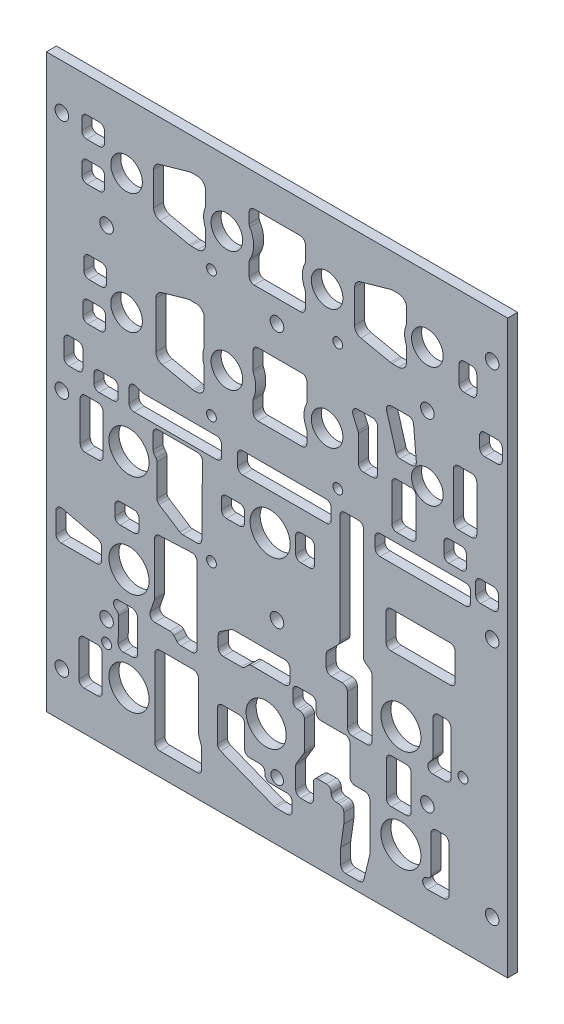
from build123d import *

# Parameters (mm, degrees)
SKETCH1_W                       = 146.05
SKETCH1_H                       = 180.975
BOSS_EXTRUDE1_DEPTH             = 3.175
F_6_CLEARANCE_HOLE1_D           = 4.3053
F_10_0MM_DOWEL_HOLE1_D          = 10
F_1_2_0_5_DIAMETER_HOLE1_D      = 12.7
F_5_32_0_15625_DIAMETER_HOLE1_D = 3.96875
SKETCH14_R                      = 1.5875
SKETCH14_R_2                    = 1.5499969
SKETCH14_R_3                    = 1.55
CUT_EXTRUDE1_DEPTH              = 233.578231462


with BuildPart() as part:
    # Sketch1 → Boss-Extrude1 (new body)
    with BuildSketch(Plane.XY):
        with Locations((-73.025, 90.4875)):
            Rectangle(SKETCH1_W, SKETCH1_H)
    extrude(amount=-BOSS_EXTRUDE1_DEPTH)

    # #6 Clearance Hole1 (through all)
    with Locations(Plane(origin=(0, 0, -3.175), x_dir=(-1, 0, 0), z_dir=(0, 0, -1))):
        with Locations((25.4, 142.875), (73.025, 142.875), (127, 142.875), (25.4, 34.925), (73.025, 61.647038728), (127, 34.925), (4.8895, 14.2875), (141.1605, 14.2875), (4.8895, 90.4875), (141.1605, 90.4875), (141.1605, 166.6875), (4.8895, 166.6875)):
            Hole(F_6_CLEARANCE_HOLE1_D / 2)

    # Ø10.0mm Dowel Hole1 (through all)
    with Locations(Plane(origin=(0, 0, -3.175), x_dir=(-1, 0, 0), z_dir=(0, 0, -1))):
        with Locations((25.4, 160.3248), (57.15, 160.3248), (88.9, 160.3248), (120.65, 160.3248), (25.4, 122.2248), (57.15, 122.2248), (88.9, 122.2248), (120.65, 122.2248)):
            Hole(F_10_0MM_DOWEL_HOLE1_D / 2)

    # 1/2 (0.5) Diameter Hole1 (through all)
    with Locations(Plane(origin=(0, 0, -3.175), x_dir=(-1, 0, 0), z_dir=(0, 0, -1))):
        with Locations((75.184, 84.455), (119.888, 84.455), (119.888, 52.07), (33.782, 52.07), (33.782, 19.685), (119.888, 19.685), (76.454, 31.496)):
            Hole(F_1_2_0_5_DIAMETER_HOLE1_D / 2)

    # 5/32 (0.15625) Diameter Hole1 (through all)
    with Locations(Plane(origin=(0, 0, -3.175), x_dir=(-1, 0, 0), z_dir=(0, 0, -1))):
        with Locations((72.963204011, 18.468172011)):
            Hole(F_5_32_0_15625_DIAMETER_HOLE1_D / 2)

    # Sketch14 → Cut-Extrude1 (cut, through all)
    with BuildSketch(Plane(origin=(0, 0, -3.175), x_dir=(-1, 0, 0), z_dir=(0, 0, -1))):
        with Locations((14.132946824, 47.879219258)):
            Circle(SKETCH14_R)
        with Locations((126.963022534, 28.317577565)):
            Circle(SKETCH14_R)
        with Locations((53.772115863, 147.294739596)):
            Circle(SKETCH14_R_2)
        with Locations((93.772115863, 147.294739596)):
            Circle(SKETCH14_R_3)
        with Locations((53.772115863, 107.294739596)):
            Circle(SKETCH14_R_3)
        with Locations((93.772115863, 107.294739596)):
            Circle(SKETCH14_R_3)
        with Locations((93.772115863, 67.294739596)):
            Circle(SKETCH14_R_3)
        with BuildLine():
            Line((9.767217663, 160.63285084), (9.767217663, 155.327245177))
            ThreePointArc((9.767217663, 155.327245177), (10.232185648, 154.204713162), (11.354717663, 153.739745177))
            Line((11.354717663, 153.739745177), (13.801478439, 153.739745177))
            ThreePointArc((13.801478439, 153.739745177), (14.924010454, 154.204713162), (15.388978439, 155.327245177))
            Line((15.388978439, 155.327245177), (15.388978439, 160.63285084))
            ThreePointArc((15.388978439, 160.63285084), (14.924010454, 161.755382855), (13.801478439, 162.22035084))
            Line((13.801478439, 162.22035084), (11.354717663, 162.22035084))
            ThreePointArc((11.354717663, 162.22035084), (10.232185648, 161.755382855), (9.767217663, 160.63285084))
        make_face()
        with BuildLine():
            Line((34.558637989, 170.414185492), (36.400339795, 170.414185492))
            ThreePointArc((36.400339795, 170.414185492), (36.751612031, 170.389778427), (37.09613346, 170.317026292))
            Line((37.09613346, 170.317026292), (46.619141898, 167.604590452))
            ThreePointArc((46.619141898, 167.604590452), (47.950528037, 166.692155495), (48.463348234, 165.161749652))
            Line((48.463348234, 165.161749652), (48.463348234, 154.740614372))
            ThreePointArc((48.463348234, 154.740614372), (47.896464908, 153.14111114), (46.448851707, 152.255569886))
            Line((46.448851707, 152.255569886), (37.123509045, 150.283573011))
            ThreePointArc((37.123509045, 150.283573011), (36.862190171, 150.242393735), (36.598005572, 150.228617497))
            Line((36.598005572, 150.228617497), (34.558637989, 150.228617497))
            ThreePointArc((34.558637989, 150.228617497), (32.762586765, 150.972566273), (32.018637989, 152.768617497))
            Line((32.018637989, 152.768617497), (32.018637989, 156.939609479))
            ThreePointArc((32.018637989, 156.939609479), (32.057812591, 157.383988064), (32.17412801, 157.814659282))
            ThreePointArc((32.17412801, 157.814659282), (32.61698961, 160.306947565), (32.17412801, 162.799235847))
            ThreePointArc((32.17412801, 162.799235847), (32.057812591, 163.229907066), (32.018637989, 163.67428565))
            Line((32.018637989, 163.67428565), (32.018637989, 167.874185492))
            ThreePointArc((32.018637989, 167.874185492), (32.762586765, 169.670236716), (34.558637989, 170.414185492))
        make_face()
        with BuildLine():
            Line((98.211458819, 170.8080376), (100.053160625, 170.8080376))
            ThreePointArc((100.053160625, 170.8080376), (100.40443286, 170.783630536), (100.748954289, 170.710878401))
            Line((100.748954289, 170.710878401), (110.271962728, 167.998442561))
            ThreePointArc((110.271962728, 167.998442561), (111.603348866, 167.086007604), (112.116169063, 165.55560176))
            Line((112.116169063, 165.55560176), (112.116169063, 155.13446648))
            ThreePointArc((112.116169063, 155.13446648), (111.549285738, 153.534963248), (110.101672537, 152.649421994))
            Line((110.101672537, 152.649421994), (100.776329875, 150.677425119))
            ThreePointArc((100.776329875, 150.677425119), (100.515011, 150.636245843), (100.250826401, 150.622469606))
            Line((100.250826401, 150.622469606), (98.211458819, 150.622469606))
            ThreePointArc((98.211458819, 150.622469606), (96.415407595, 151.366418381), (95.671458819, 153.162469606))
            Line((95.671458819, 153.162469606), (95.671458819, 157.333461588))
            ThreePointArc((95.671458819, 157.333461588), (95.71063342, 157.777840172), (95.82694884, 158.208511391))
            ThreePointArc((95.82694884, 158.208511391), (96.26981044, 160.700799673), (95.82694884, 163.193087955))
            ThreePointArc((95.82694884, 163.193087955), (95.71063342, 163.623759174), (95.671458819, 164.068137758))
            Line((95.671458819, 164.068137758), (95.671458819, 168.2680376))
            ThreePointArc((95.671458819, 168.2680376), (96.415407595, 170.064088824), (98.211458819, 170.8080376))
        make_face()
        with BuildLine():
            Line((81.82809692, 169.167810595), (81.82809692, 165.880408811))
            ThreePointArc((81.82809692, 165.880408811), (81.772213791, 165.462909096), (81.608498795, 165.074803008))
            ThreePointArc((81.608498795, 165.074803008), (80.416199874, 160.700799673), (81.608498795, 156.326796338))
            ThreePointArc((81.608498795, 156.326796338), (81.772213791, 155.938690249), (81.82809692, 155.521190535))
            Line((81.82809692, 155.521190535), (81.82809692, 151.496551485))
            ThreePointArc((81.82809692, 151.496551485), (81.363128935, 150.37401947), (80.24059692, 149.909051485))
            Line((80.24059692, 149.909051485), (65.652230002, 149.909051485))
            ThreePointArc((65.652230002, 149.909051485), (64.529697987, 150.37401947), (64.064730002, 151.496551485))
            Line((64.064730002, 151.496551485), (64.064730002, 156.208791944))
            ThreePointArc((64.064730002, 156.208791944), (64.104453531, 156.561700215), (64.221636141, 156.896947054))
            ThreePointArc((64.221636141, 156.896947054), (64.999149824, 160.306947565), (64.221636141, 163.716948075))
            ThreePointArc((64.221636141, 163.716948075), (64.104453531, 164.052194914), (64.064730002, 164.405103185))
            Line((64.064730002, 164.405103185), (64.064730002, 169.167810595))
            ThreePointArc((64.064730002, 169.167810595), (64.529697987, 170.29034261), (65.652230002, 170.755310595))
            Line((65.652230002, 170.755310595), (80.24059692, 170.755310595))
            ThreePointArc((80.24059692, 170.755310595), (81.363128935, 170.29034261), (81.82809692, 169.167810595))
        make_face()
        with BuildLine():
            Line((129.251171634, 170.067348882), (133.253874874, 170.067348882))
            ThreePointArc((133.253874874, 170.067348882), (134.376406889, 169.602380897), (134.841374874, 168.479848882))
            Line((134.841374874, 168.479848882), (134.841374874, 164.977188829))
            ThreePointArc((134.841374874, 164.977188829), (134.376406889, 163.854656814), (133.253874874, 163.389688829))
            Line((133.253874874, 163.389688829), (129.251171634, 163.389688829))
            ThreePointArc((129.251171634, 163.389688829), (128.128639619, 163.854656814), (127.663671634, 164.977188829))
            Line((127.663671634, 164.977188829), (127.663671634, 168.479848882))
            ThreePointArc((127.663671634, 168.479848882), (128.128639619, 169.602380897), (129.251171634, 170.067348882))
        make_face()
        with BuildLine():
            Line((129.204795221, 157.797391229), (133.207498461, 157.797391229))
            ThreePointArc((133.207498461, 157.797391229), (134.330030476, 157.332423244), (134.794998461, 156.209891229))
            Line((134.794998461, 156.209891229), (134.794998461, 152.707231176))
            ThreePointArc((134.794998461, 152.707231176), (134.330030476, 151.58469916), (133.207498461, 151.119731176))
            Line((133.207498461, 151.119731176), (129.204795221, 151.119731176))
            ThreePointArc((129.204795221, 151.119731176), (128.082263206, 151.58469916), (127.617295221, 152.707231176))
            Line((127.617295221, 152.707231176), (127.617295221, 156.209891229))
            ThreePointArc((127.617295221, 156.209891229), (128.082263206, 157.332423244), (129.204795221, 157.797391229))
        make_face()
        with BuildLine():
            Line((9.767217663, 131.102811501), (9.767217663, 116.698032313))
            ThreePointArc((9.767217663, 116.698032313), (10.232185648, 115.575500298), (11.354717663, 115.110532313))
            Line((11.354717663, 115.110532313), (15.532798381, 115.110532313))
            ThreePointArc((15.532798381, 115.110532313), (16.655330396, 115.575500298), (17.120298381, 116.698032313))
            Line((17.120298381, 116.698032313), (17.120298381, 131.102811501))
            ThreePointArc((17.120298381, 131.102811501), (16.655330396, 132.225343516), (15.532798381, 132.690311501))
            Line((15.532798381, 132.690311501), (11.354717663, 132.690311501))
            ThreePointArc((11.354717663, 132.690311501), (10.232185648, 132.225343516), (9.767217663, 131.102811501))
        make_face()
        with BuildLine():
            Line((3.261554384, 146.026764327), (7.264257624, 146.026764327))
            ThreePointArc((7.264257624, 146.026764327), (8.386789639, 145.561796342), (8.851757624, 144.439264327))
            Line((8.851757624, 144.439264327), (8.851757624, 140.936604274))
            ThreePointArc((8.851757624, 140.936604274), (8.386789639, 139.814072259), (7.264257624, 139.349104274))
            Line((7.264257624, 139.349104274), (3.261554384, 139.349104274))
            ThreePointArc((3.261554384, 139.349104274), (2.139022369, 139.814072259), (1.674054384, 140.936604274))
            Line((1.674054384, 140.936604274), (1.674054384, 144.439264327))
            ThreePointArc((1.674054384, 144.439264327), (2.139022369, 145.561796342), (3.261554384, 146.026764327))
        make_face()
        with BuildLine():
            Line((31.359794028, 138.489073114), (36.77295297, 138.489073114))
            ThreePointArc((36.77295297, 138.489073114), (38.043028477, 137.85397243), (38.296882474, 136.456831485))
            Line((38.296882474, 136.456831485), (35.332112308, 126.297897775))
            ThreePointArc((35.332112308, 126.297897775), (34.86364945, 125.621401108), (34.083001786, 125.361219601))
            Line((34.083001786, 125.361219601), (30.477613082, 125.361219601))
            ThreePointArc((30.477613082, 125.361219601), (29.306574985, 125.87688658), (28.896312545, 127.088879727))
            Line((28.896312545, 127.088879727), (29.77849349, 137.04173324))
            ThreePointArc((29.77849349, 137.04173324), (30.287961007, 138.072611211), (31.359794028, 138.489073114))
        make_face()
        with BuildLine():
            Line((48.956021583, 130.010128428), (47.363025781, 126.342086289))
            ThreePointArc((47.363025781, 126.342086289), (47.264830788, 126.032651426), (47.231636398, 125.709711302))
            Line((47.231636398, 125.709711302), (47.231636398, 117.491438614))
            ThreePointArc((47.231636398, 117.491438614), (46.766668413, 116.368906599), (45.644136398, 115.903938614))
            Line((45.644136398, 115.903938614), (42.729312579, 115.903938614))
            ThreePointArc((42.729312579, 115.903938614), (41.606780564, 116.368906599), (41.141812579, 117.491438614))
            Line((41.141812579, 117.491438614), (41.141812579, 130.642503415))
            ThreePointArc((41.141812579, 130.642503415), (41.606780564, 131.76503543), (42.729312579, 132.230003415))
            Line((42.729312579, 132.230003415), (47.499910967, 132.230003415))
            ThreePointArc((47.499910967, 132.230003415), (48.827324155, 131.5132103), (48.956021583, 130.010128428))
        make_face()
        with BuildLine():
            Line((80.603672304, 131.719817461), (80.603672304, 126.35381328))
            ThreePointArc((80.603672304, 126.35381328), (80.572361135, 126.040073625), (80.479662765, 125.738710102))
            ThreePointArc((80.479662765, 125.738710102), (79.767632234, 122.206947565), (80.479662765, 118.675185027))
            ThreePointArc((80.479662765, 118.675185027), (80.572361135, 118.373821505), (80.603672304, 118.060081849))
            Line((80.603672304, 118.060081849), (80.603672304, 114.804299681))
            ThreePointArc((80.603672304, 114.804299681), (80.138704319, 113.681767665), (79.016172304, 113.216799681))
            Line((79.016172304, 113.216799681), (65.155894554, 113.216799681))
            ThreePointArc((65.155894554, 113.216799681), (64.033362539, 113.681767665), (63.568394554, 114.804299681))
            Line((63.568394554, 114.804299681), (63.568394554, 118.242922096))
            ThreePointArc((63.568394554, 118.242922096), (63.609998563, 118.603978648), (63.732629936, 118.946110602))
            ThreePointArc((63.732629936, 118.946110602), (64.494224867, 122.206947565), (63.732629936, 125.467784527))
            ThreePointArc((63.732629936, 125.467784527), (63.609998563, 125.809916481), (63.568394554, 126.170973033))
            Line((63.568394554, 126.170973033), (63.568394554, 131.719817461))
            ThreePointArc((63.568394554, 131.719817461), (64.033362539, 132.842349477), (65.155894554, 133.307317461))
            Line((65.155894554, 133.307317461), (79.016172304, 133.307317461))
            ThreePointArc((79.016172304, 133.307317461), (80.138704319, 132.842349477), (80.603672304, 131.719817461))
        make_face()
        with BuildLine():
            Line((98.598195781, 135.620186627), (100.64553407, 135.620186627))
            ThreePointArc((100.64553407, 135.620186627), (100.996806305, 135.595779562), (101.341327735, 135.523027428))
            Line((101.341327735, 135.523027428), (109.530233549, 133.190583666))
            ThreePointArc((109.530233549, 133.190583666), (110.861619688, 132.278148709), (111.374439884, 130.747742866))
            Line((111.374439884, 130.747742866), (111.374439884, 116.007403466))
            ThreePointArc((111.374439884, 116.007403466), (110.807556559, 114.407900235), (109.359943358, 113.52235898))
            Line((109.359943358, 113.52235898), (99.664902592, 111.472183369))
            ThreePointArc((99.664902592, 111.472183369), (99.403583717, 111.431004093), (99.139399118, 111.417227855))
            Line((99.139399118, 111.417227855), (98.598195781, 111.417227855))
            ThreePointArc((98.598195781, 111.417227855), (96.802144557, 112.161176631), (96.058195781, 113.957227855))
            Line((96.058195781, 113.957227855), (96.058195781, 119.392794856))
            ThreePointArc((96.058195781, 119.392794856), (96.081326261, 119.6829365), (96.150133393, 119.965748754))
            ThreePointArc((96.150133393, 119.965748754), (96.523744405, 122.294087328), (96.150133393, 124.622425902))
            ThreePointArc((96.150133393, 124.622425902), (96.081326261, 124.905238157), (96.058195781, 125.195379801))
            Line((96.058195781, 125.195379801), (96.058195781, 133.080186627))
            ThreePointArc((96.058195781, 133.080186627), (96.802144557, 134.876237851), (98.598195781, 135.620186627))
        make_face()
        with BuildLine():
            Line((128.583632907, 131.935602041), (132.586336146, 131.935602041))
            ThreePointArc((132.586336146, 131.935602041), (133.708868161, 131.470634056), (134.173836146, 130.348102041))
            Line((134.173836146, 130.348102041), (134.173836146, 126.845441988))
            ThreePointArc((134.173836146, 126.845441988), (133.708868161, 125.722909973), (132.586336146, 125.257941988))
            Line((132.586336146, 125.257941988), (128.583632907, 125.257941988))
            ThreePointArc((128.583632907, 125.257941988), (127.461100891, 125.722909973), (126.996132907, 126.845441988))
            Line((126.996132907, 126.845441988), (126.996132907, 130.348102041))
            ThreePointArc((126.996132907, 130.348102041), (127.461100891, 131.470634056), (128.583632907, 131.935602041))
        make_face()
        with BuildLine():
            Line((128.895482339, 119.575386698), (132.898185579, 119.575386698))
            ThreePointArc((132.898185579, 119.575386698), (134.020717594, 119.110418713), (134.485685579, 117.987886698))
            Line((134.485685579, 117.987886698), (134.485685579, 114.485226645))
            ThreePointArc((134.485685579, 114.485226645), (134.020717594, 113.36269463), (132.898185579, 112.897726645))
            Line((132.898185579, 112.897726645), (128.895482339, 112.897726645))
            ThreePointArc((128.895482339, 112.897726645), (127.772950324, 113.36269463), (127.307982339, 114.485226645))
            Line((127.307982339, 114.485226645), (127.307982339, 117.987886698))
            ThreePointArc((127.307982339, 117.987886698), (127.772950324, 119.110418713), (128.895482339, 119.575386698))
        make_face()
        with BuildLine():
            Line((134.485685579, 99.964724525), (134.485685579, 105.096456724))
            ThreePointArc((134.485685579, 105.096456724), (134.950653564, 106.218988739), (136.073185579, 106.683956724))
            Line((136.073185579, 106.683956724), (138.881785017, 106.683956724))
            ThreePointArc((138.881785017, 106.683956724), (140.004317032, 106.218988739), (140.469285017, 105.096456724))
            Line((140.469285017, 105.096456724), (140.469285017, 99.964724525))
            ThreePointArc((140.469285017, 99.964724525), (140.004317032, 98.84219251), (138.881785017, 98.377224525))
            Line((138.881785017, 98.377224525), (136.073185579, 98.377224525))
            ThreePointArc((136.073185579, 98.377224525), (134.950653564, 98.84219251), (134.485685579, 99.964724525))
        make_face()
        with BuildLine():
            Line((4.517320575, 105.101609763), (8.520023814, 105.101609763))
            ThreePointArc((8.520023814, 105.101609763), (9.642555829, 104.636641778), (10.107523814, 103.514109763))
            Line((10.107523814, 103.514109763), (10.107523814, 100.01144971))
            ThreePointArc((10.107523814, 100.01144971), (9.642555829, 98.888917695), (8.520023814, 98.42394971))
            Line((8.520023814, 98.42394971), (4.517320575, 98.42394971))
            ThreePointArc((4.517320575, 98.42394971), (3.39478856, 98.888917695), (2.929820575, 100.01144971))
            Line((2.929820575, 100.01144971), (2.929820575, 103.514109763))
            ThreePointArc((2.929820575, 103.514109763), (3.39478856, 104.636641778), (4.517320575, 105.101609763))
        make_face()
        with BuildLine():
            Line((14.590947251, 111.137221793), (18.593650491, 111.137221793))
            ThreePointArc((18.593650491, 111.137221793), (19.716182506, 110.672253808), (20.181150491, 109.549721793))
            Line((20.181150491, 109.549721793), (20.181150491, 106.04706174))
            ThreePointArc((20.181150491, 106.04706174), (19.716182506, 104.924529725), (18.593650491, 104.45956174))
            Line((18.593650491, 104.45956174), (14.590947251, 104.45956174))
            ThreePointArc((14.590947251, 104.45956174), (13.468415236, 104.924529725), (13.003447251, 106.04706174))
            Line((13.003447251, 106.04706174), (13.003447251, 109.549721793))
            ThreePointArc((13.003447251, 109.549721793), (13.468415236, 110.672253808), (14.590947251, 111.137221793))
        make_face()
        with BuildLine():
            Line((30.535303828, 119.204834387), (35.092795143, 119.204834387))
            ThreePointArc((35.092795143, 119.204834387), (36.215327158, 118.739866403), (36.680295143, 117.617334387))
            Line((36.680295143, 117.617334387), (36.680295143, 106.231957658))
            ThreePointArc((36.680295143, 106.231957658), (36.215327158, 105.109425643), (35.092795143, 104.644457658))
            Line((35.092795143, 104.644457658), (30.535303828, 104.644457658))
            ThreePointArc((30.535303828, 104.644457658), (29.412771813, 105.109425643), (28.947803828, 106.231957658))
            Line((28.947803828, 106.231957658), (28.947803828, 117.617334387))
            ThreePointArc((28.947803828, 117.617334387), (29.412771813, 118.739866403), (30.535303828, 119.204834387))
        make_face()
        with BuildLine():
            Line((45.644136398, 65.153455838), (45.644136398, 100.334854986))
            ThreePointArc((45.644136398, 100.334854986), (46.109104382, 101.457387001), (47.231636398, 101.922354986))
            Line((47.231636398, 101.922354986), (51.530299417, 101.922354986))
            ThreePointArc((51.530299417, 101.922354986), (52.652831432, 101.457387001), (53.117799417, 100.334854986))
            Line((53.117799417, 100.334854986), (53.117799417, 65.783517616))
            ThreePointArc((53.117799417, 65.783517616), (53.238640659, 65.176007667), (53.582767402, 64.6609856))
            Line((53.582767402, 64.6609856), (56.969013712, 61.27473929))
            ThreePointArc((56.969013712, 61.27473929), (57.313140455, 60.759717224), (57.433981697, 60.152207275))
            Line((57.433981697, 60.152207275), (57.433981697, 56.397932406))
            ThreePointArc((57.433981697, 56.397932406), (56.969013712, 55.27540039), (55.846481697, 54.810432406))
            Line((55.846481697, 54.810432406), (52.343430559, 54.810432406))
            ThreePointArc((52.343430559, 54.810432406), (51.220898544, 54.345464421), (50.755930559, 53.222932406))
            Line((50.755930559, 53.222932406), (50.755930559, 43.368905462))
            ThreePointArc((50.755930559, 43.368905462), (50.290962575, 42.246373447), (49.168430559, 41.781405462))
            Line((49.168430559, 41.781405462), (44.55012145, 41.781405462))
            ThreePointArc((44.55012145, 41.781405462), (43.427589434, 42.246373447), (42.96262145, 43.368905462))
            Line((42.96262145, 43.368905462), (42.96262145, 61.595277105))
            ThreePointArc((42.96262145, 61.595277105), (43.136999443, 62.318632096), (43.621824528, 62.88307409))
            Line((43.621824528, 62.88307409), (44.984933319, 63.865658852))
            ThreePointArc((44.984933319, 63.865658852), (45.469758404, 64.430100846), (45.644136398, 65.153455838))
        make_face()
        with BuildLine():
            Line((67.111744061, 82.728660412), (67.111744061, 87.763891138))
            ThreePointArc((67.111744061, 87.763891138), (66.646776076, 88.886423153), (65.524244061, 89.351391138))
            Line((65.524244061, 89.351391138), (62.708939108, 89.351391138))
            ThreePointArc((62.708939108, 89.351391138), (61.586407093, 88.886423153), (61.121439108, 87.763891138))
            Line((61.121439108, 87.763891138), (61.121439108, 82.728660412))
            ThreePointArc((61.121439108, 82.728660412), (61.586407093, 81.606128397), (62.708939108, 81.141160412))
            Line((62.708939108, 81.141160412), (65.524244061, 81.141160412))
            ThreePointArc((65.524244061, 81.141160412), (66.646776076, 81.606128397), (67.111744061, 82.728660412))
        make_face()
        with BuildLine():
            Line((17.962804382, 45.688766309), (17.962804382, 59.68723929))
            ThreePointArc((17.962804382, 59.68723929), (18.427772367, 60.809771305), (19.550304382, 61.27473929))
            Line((19.550304382, 61.27473929), (21.993380848, 61.27473929))
            ThreePointArc((21.993380848, 61.27473929), (23.115912863, 60.809771305), (23.580880848, 59.68723929))
            Line((23.580880848, 59.68723929), (23.580880848, 48.891130409))
            ThreePointArc((23.580880848, 48.891130409), (23.674732752, 48.353383614), (23.945191545, 47.879219258))
            Line((23.945191545, 47.879219258), (24.920167032, 46.70067746))
            ThreePointArc((24.920167032, 46.70067746), (25.133390831, 45.012842017), (23.696977728, 44.101266309))
            Line((23.696977728, 44.101266309), (19.550304382, 44.101266309))
            ThreePointArc((19.550304382, 44.101266309), (18.427772367, 44.566234294), (17.962804382, 45.688766309))
        make_face()
        with BuildLine():
            Line((25.488561941, 14.767801201), (25.65889639, 14.748652835))
            ThreePointArc((25.65889639, 14.748652835), (24.652667298, 15.268240779), (24.248740174, 16.326215966))
            Line((24.248740174, 16.326215966), (24.248740174, 27.680199317))
            ThreePointArc((24.248740174, 27.680199317), (23.783772189, 28.802731332), (22.661240174, 29.267699317))
            Line((22.661240174, 29.267699317), (20.181150491, 29.267699317))
            ThreePointArc((20.181150491, 29.267699317), (19.058618476, 28.802731332), (18.593650491, 27.680199317))
            Line((18.593650491, 27.680199317), (18.593650491, 13.275487543))
            ThreePointArc((18.593650491, 13.275487543), (19.049331281, 12.162320203), (20.154773674, 11.688206688))
            Line((20.154773674, 11.688206688), (25.28484134, 11.602957215))
            ThreePointArc((25.28484134, 11.602957215), (26.895439455, 13.088261949), (25.488561941, 14.767801201))
        make_face()
        with BuildLine():
            Line((32.122803828, 42.542696767), (36.816509998, 42.542696767))
            ThreePointArc((36.816509998, 42.542696767), (37.939042014, 42.077728782), (38.404009998, 40.955196767))
            Line((38.404009998, 40.955196767), (38.404009998, 30.172891696))
            ThreePointArc((38.404009998, 30.172891696), (37.939042014, 29.050359681), (36.816509998, 28.585391696))
            Line((36.816509998, 28.585391696), (32.122803828, 28.585391696))
            ThreePointArc((32.122803828, 28.585391696), (31.000271813, 29.050359681), (30.535303828, 30.172891696))
            Line((30.535303828, 30.172891696), (30.535303828, 40.955196767))
            ThreePointArc((30.535303828, 40.955196767), (31.000271813, 42.077728782), (32.122803828, 42.542696767))
        make_face()
        with BuildLine():
            Line((43.621824528, 25.252329968), (43.621824528, 12.239202135))
            ThreePointArc((43.621824528, 12.239202135), (43.632678938, 12.053878272), (43.665093737, 11.871088684))
            Line((43.665093737, 11.871088684), (43.69525068, 11.744580727))
            Line((43.69525068, 11.744580727), (45.483963354, 4.240955996))
            ThreePointArc((45.483963354, 4.240955996), (46.044381118, 3.363168898), (47.028194145, 3.021569446))
            Line((47.028194145, 3.021569446), (51.26309524, 3.021569446))
            ThreePointArc((51.26309524, 3.021569446), (52.385627255, 3.486537431), (52.85059524, 4.609069446))
            Line((52.85059524, 4.609069446), (52.85059524, 9.285301796))
            ThreePointArc((52.85059524, 9.285301796), (52.846511055, 9.399102525), (52.834279516, 9.512317701))
            Line((52.834279516, 9.512317701), (51.87474445, 16.153290332))
            ThreePointArc((51.87474445, 16.153290332), (51.862512911, 16.266505507), (51.858428726, 16.380306236))
            Line((51.858428726, 16.380306236), (51.858428726, 19.480780516))
            ThreePointArc((51.858428726, 19.480780516), (52.323396711, 20.603312531), (53.445928726, 21.068280516))
            Line((53.445928726, 21.068280516), (54.258981697, 21.068280516))
            ThreePointArc((54.258981697, 21.068280516), (55.381513712, 21.533248501), (55.846481697, 22.655780516))
            Line((55.846481697, 22.655780516), (55.846481697, 22.952945823))
            ThreePointArc((55.846481697, 22.952945823), (56.311449682, 24.075477838), (57.433981697, 24.540445823))
            Line((57.433981697, 24.540445823), (59.92389745, 24.540445823))
            ThreePointArc((59.92389745, 24.540445823), (61.046429465, 24.075477838), (61.51139745, 22.952945823))
            Line((61.51139745, 22.952945823), (61.51139745, 18.130277566))
            ThreePointArc((61.51139745, 18.130277566), (61.976365435, 17.00774555), (63.09889745, 16.542777566))
            Line((63.09889745, 16.542777566), (65.524244061, 16.542777566))
            ThreePointArc((65.524244061, 16.542777566), (66.646776076, 17.00774555), (67.111744061, 18.130277566))
            Line((67.111744061, 18.130277566), (67.111744061, 24.586833106))
            ThreePointArc((67.111744061, 24.586833106), (67.053548088, 25.012726807), (66.883226966, 25.407394935))
            Line((66.883226966, 25.407394935), (64.552352596, 29.267699317))
            ThreePointArc((64.552352596, 29.267699317), (64.382031474, 29.662367445), (64.323835501, 30.088261146))
            Line((64.323835501, 30.088261146), (64.323835501, 38.924226777))
            ThreePointArc((64.323835501, 38.924226777), (64.777980628, 39.91970434), (65.768349816, 40.38488414))
            Line((65.768349816, 40.38488414), (66.583495086, 40.456212154))
            ThreePointArc((66.583495086, 40.456212154), (67.615547791, 40.965178334), (68.032612157, 42.037669208))
            Line((68.032612157, 42.037669208), (68.032612157, 44.997953003))
            ThreePointArc((68.032612157, 44.997953003), (67.567644172, 46.120485018), (66.445112157, 46.585453003))
            Line((66.445112157, 46.585453003), (62.237892426, 46.585453003))
            ThreePointArc((62.237892426, 46.585453003), (61.115360411, 46.120485018), (60.650392426, 44.997953003))
            Line((60.650392426, 44.997953003), (60.650392426, 42.599158672))
            ThreePointArc((60.650392426, 42.599158672), (60.185424441, 41.476626656), (59.062892426, 41.011658672))
            Line((59.062892426, 41.011658672), (51.495094787, 41.011658672))
            ThreePointArc((51.495094787, 41.011658672), (50.372562772, 40.546690687), (49.907594787, 39.424158672))
            Line((49.907594787, 39.424158672), (49.907594787, 30.172891696))
            ThreePointArc((49.907594787, 30.172891696), (49.442626802, 29.050359681), (48.320094787, 28.585391696))
            Line((48.320094787, 28.585391696), (45.209324528, 28.585391696))
            ThreePointArc((45.209324528, 28.585391696), (44.086792513, 28.120423711), (43.621824528, 26.997891696))
            Line((43.621824528, 26.997891696), (43.621824528, 25.252329968))
        make_face()
        with BuildLine():
            Line((68.955267824, 46.654614196), (68.955267824, 50.449415892))
            ThreePointArc((68.955267824, 50.449415892), (69.420235809, 51.571947907), (70.542767824, 52.036915892))
            Line((70.542767824, 52.036915892), (86.63255067, 52.036915892))
            ThreePointArc((86.63255067, 52.036915892), (87.077806475, 51.973195245), (87.487318043, 51.78714867))
            Line((87.487318043, 51.78714867), (90.894411426, 49.610127739))
            ThreePointArc((90.894411426, 49.610127739), (91.431962166, 49.035026275), (91.627144053, 48.27239496))
            Line((91.627144053, 48.27239496), (91.627144053, 44.760968252))
            ThreePointArc((91.627144053, 44.760968252), (91.162176068, 43.638436237), (90.039644053, 43.173468252))
            Line((90.039644053, 43.173468252), (84.301424443, 43.173468252))
            ThreePointArc((84.301424443, 43.173468252), (83.693914494, 43.294309494), (83.178892427, 43.638436237))
            Line((83.178892427, 43.638436237), (82.12970624, 44.687622425))
            ThreePointArc((82.12970624, 44.687622425), (81.608681763, 45.034221081), (80.994191404, 45.152537321))
            Line((80.994191404, 45.152537321), (70.555750644, 45.067167285))
            ThreePointArc((70.555750644, 45.067167285), (69.424835352, 45.527501408), (68.955267824, 46.654614196))
        make_face()
        with BuildLine():
            Line((91.912830974, 18.298973395), (91.912830974, 28.11335216))
            ThreePointArc((91.912830974, 28.11335216), (91.447862989, 29.235884175), (90.325330974, 29.70085216))
            Line((90.325330974, 29.70085216), (84.88947102, 29.70085216))
            ThreePointArc((84.88947102, 29.70085216), (83.766939005, 29.235884175), (83.30197102, 28.11335216))
            Line((83.30197102, 28.11335216), (83.30197102, 21.12355132))
            ThreePointArc((83.30197102, 21.12355132), (82.837003035, 20.001019305), (81.71447102, 19.53605132))
            Line((81.71447102, 19.53605132), (78.443784352, 19.53605132))
            ThreePointArc((78.443784352, 19.53605132), (77.321252337, 19.071083335), (76.856284352, 17.94855132))
            Line((76.856284352, 17.94855132), (76.856284352, 17.380743472))
            ThreePointArc((76.856284352, 17.380743472), (76.391316367, 16.258211457), (75.268784352, 15.793243472))
            Line((75.268784352, 15.793243472), (69.818441453, 15.793243472))
            ThreePointArc((69.818441453, 15.793243472), (68.695909438, 15.328275487), (68.230941453, 14.205743472))
            Line((68.230941453, 14.205743472), (68.230941453, 11.593979237))
            ThreePointArc((68.230941453, 11.593979237), (68.695909438, 10.471447222), (69.818441453, 10.006479237))
            Line((69.818441453, 10.006479237), (73.388100038, 10.006479237))
            ThreePointArc((73.388100038, 10.006479237), (73.685530866, 10.034591167), (73.972427703, 10.117931328))
            Line((73.972427703, 10.117931328), (90.909658639, 16.822925486))
            ThreePointArc((90.909658639, 16.822925486), (91.638300208, 17.406634871), (91.912830974, 18.298973395))
        make_face()
        with BuildLine():
            Line((84.848928202, 87.763891138), (89.065440256, 87.763891138))
            ThreePointArc((89.065440256, 87.763891138), (90.187972271, 87.298923153), (90.652940256, 86.176391138))
            Line((90.652940256, 86.176391138), (90.652940256, 83.104642863))
            ThreePointArc((90.652940256, 83.104642863), (90.187972271, 81.982110847), (89.065440256, 81.517142863))
            Line((89.065440256, 81.517142863), (84.848928202, 81.517142863))
            ThreePointArc((84.848928202, 81.517142863), (83.726396187, 81.982110847), (83.261428202, 83.104642863))
            Line((83.261428202, 83.104642863), (83.261428202, 86.176391138))
            ThreePointArc((83.261428202, 86.176391138), (83.726396187, 87.298923153), (84.848928202, 87.763891138))
        make_face()
        with BuildLine():
            Line((129.719832819, 92.920324011), (133.746574015, 92.920324011))
            ThreePointArc((133.746574015, 92.920324011), (134.86910603, 92.455356026), (135.334074015, 91.332824011))
            Line((135.334074015, 91.332824011), (135.334074015, 78.857031803))
            ThreePointArc((135.334074015, 78.857031803), (134.86910603, 77.734499788), (133.746574015, 77.269531803))
            Line((133.746574015, 77.269531803), (129.719832819, 77.269531803))
            ThreePointArc((129.719832819, 77.269531803), (128.597300803, 77.734499788), (128.132332819, 78.857031803))
            Line((128.132332819, 78.857031803), (128.132332819, 91.332824011))
            ThreePointArc((128.132332819, 91.332824011), (128.597300803, 92.455356026), (129.719832819, 92.920324011))
        make_face()
        with BuildLine():
            Line((143.019985315, 56.717315352), (143.019985315, 50.184019447))
            ThreePointArc((143.019985315, 50.184019447), (142.55501733, 49.061487431), (141.432485315, 48.596519447))
            Line((141.432485315, 48.596519447), (130.171132907, 48.596519447))
            ThreePointArc((130.171132907, 48.596519447), (129.048600891, 49.061487431), (128.583632907, 50.184019447))
            Line((128.583632907, 50.184019447), (128.583632907, 54.036010936))
            ThreePointArc((128.583632907, 54.036010936), (128.925363595, 55.019990138), (129.803431422, 55.580339873))
            Line((129.803431422, 55.580339873), (141.06478383, 58.26164429))
            ThreePointArc((141.06478383, 58.26164429), (142.416464517, 57.963084664), (143.019985315, 56.717315352))
        make_face()
        with BuildLine():
            Line((135.733601408, 24.895379819), (135.733601408, 14.058917599))
            ThreePointArc((135.733601408, 14.058917599), (135.268633423, 12.936385584), (134.146101408, 12.471417599))
            Line((134.146101408, 12.471417599), (129.950688404, 12.471417599))
            ThreePointArc((129.950688404, 12.471417599), (128.828156389, 12.936385584), (128.363188404, 14.058917599))
            Line((128.363188404, 14.058917599), (128.363188404, 24.895379819))
            ThreePointArc((128.363188404, 24.895379819), (128.828156389, 26.017911835), (129.950688404, 26.482879819))
            Line((129.950688404, 26.482879819), (134.146101408, 26.482879819))
            ThreePointArc((134.146101408, 26.482879819), (135.268633423, 26.017911835), (135.733601408, 24.895379819))
        make_face()
        with BuildLine():
            Line((98.437411263, 70.123191958), (102.926957711, 70.123191958))
            ThreePointArc((102.926957711, 70.123191958), (103.378843137, 70.188865485), (103.79334033, 70.380452352))
            Line((103.79334033, 70.380452352), (110.329584995, 74.637496535))
            ThreePointArc((110.329584995, 74.637496535), (110.858827443, 75.211173571), (111.050702376, 75.96773614))
            Line((111.050702376, 75.96773614), (111.050702376, 86.020535796))
            ThreePointArc((111.050702376, 86.020535796), (111.125087816, 86.500786332), (111.341273183, 86.936030699))
            Line((111.341273183, 86.936030699), (111.963646468, 87.817711284))
            ThreePointArc((111.963646468, 87.817711284), (112.179831835, 88.252955651), (112.254217275, 88.733206187))
            Line((112.254217275, 88.733206187), (112.254217275, 93.434843616))
            ThreePointArc((112.254217275, 93.434843616), (111.78924929, 94.557375631), (110.666717275, 95.022343616))
            Line((110.666717275, 95.022343616), (98.214706811, 95.022343616))
            ThreePointArc((98.214706811, 95.022343616), (97.086435967, 94.551607312), (96.627290221, 93.418570265))
            Line((96.627290221, 93.418570265), (96.849994673, 71.694418607))
            ThreePointArc((96.849994673, 71.694418607), (97.320647567, 70.582421114), (98.437411263, 70.123191958))
        make_face()
        with BuildLine():
            Line((13.28672823, 101.718890773), (40.392708584, 101.718890773))
            ThreePointArc((40.392708584, 101.718890773), (41.515240599, 101.253922788), (41.980208584, 100.131390773))
            Line((41.980208584, 100.131390773), (41.980208584, 96.963546594))
            ThreePointArc((41.980208584, 96.963546594), (41.515240599, 95.841014579), (40.392708584, 95.376046594))
            Line((40.392708584, 95.376046594), (13.28672823, 95.376046594))
            ThreePointArc((13.28672823, 95.376046594), (12.164196215, 95.841014579), (11.69922823, 96.963546594))
            Line((11.69922823, 96.963546594), (11.69922823, 100.131390773))
            ThreePointArc((11.69922823, 100.131390773), (12.164196215, 101.253922788), (13.28672823, 101.718890773))
        make_face()
        with BuildLine():
            Line((83.921634773, 102.625071879), (57.433981697, 102.625071879))
            ThreePointArc((57.433981697, 102.625071879), (56.311449682, 102.160103894), (55.846481697, 101.037571879))
            Line((55.846481697, 101.037571879), (55.846481697, 97.601721607))
            ThreePointArc((55.846481697, 97.601721607), (56.311449682, 96.479189591), (57.433981697, 96.014221607))
            Line((57.433981697, 96.014221607), (83.921634773, 96.014221607))
            ThreePointArc((83.921634773, 96.014221607), (85.044166788, 96.479189591), (85.509134773, 97.601721607))
            Line((85.509134773, 97.601721607), (85.509134773, 101.037571879))
            ThreePointArc((85.509134773, 101.037571879), (85.044166788, 102.160103894), (83.921634773, 102.625071879))
        make_face()
        with BuildLine():
            Line((92.168891191, 102.625071879), (115.232026793, 102.625071879))
            ThreePointArc((115.232026793, 102.625071879), (115.51507018, 102.650508279), (115.7890432, 102.726002348))
            Line((115.7890432, 102.726002348), (117.711087225, 103.446190697))
            ThreePointArc((117.711087225, 103.446190697), (119.172507497, 103.264308828), (119.855603632, 101.959621165))
            Line((119.855603632, 101.959621165), (119.855603632, 97.677745024))
            ThreePointArc((119.855603632, 97.677745024), (119.390635647, 96.555213009), (118.268103632, 96.090245024))
            Line((118.268103632, 96.090245024), (92.168891191, 96.090245024))
            ThreePointArc((92.168891191, 96.090245024), (91.046359176, 96.555213009), (90.581391191, 97.677745024))
            Line((90.581391191, 97.677745024), (90.581391191, 101.037571879))
            ThreePointArc((90.581391191, 101.037571879), (91.046359176, 102.160103894), (92.168891191, 102.625071879))
        make_face()
        with BuildLine():
            Line((124.902684895, 101.959621165), (129.379109069, 101.959621165))
            ThreePointArc((129.379109069, 101.959621165), (130.501641084, 101.49465318), (130.966609069, 100.372121165))
            Line((130.966609069, 100.372121165), (130.966609069, 97.473067514))
            ThreePointArc((130.966609069, 97.473067514), (130.501641084, 96.350535499), (129.379109069, 95.885567514))
            Line((129.379109069, 95.885567514), (124.902684895, 95.885567514))
            ThreePointArc((124.902684895, 95.885567514), (123.78015288, 96.350535499), (123.315184895, 97.473067514))
            Line((123.315184895, 97.473067514), (123.315184895, 100.372121165))
            ThreePointArc((123.315184895, 100.372121165), (123.78015288, 101.49465318), (124.902684895, 101.959621165))
        make_face()
        with BuildLine():
            Line((118.286830366, 62.88307409), (122.742841132, 62.88307409))
            ThreePointArc((122.742841132, 62.88307409), (123.865373148, 63.348042075), (124.330341132, 64.47057409))
            Line((124.330341132, 64.47057409), (124.330341132, 67.66746808))
            ThreePointArc((124.330341132, 67.66746808), (123.865373148, 68.790000096), (122.742841132, 69.25496808))
            Line((122.742841132, 69.25496808), (118.286830366, 69.25496808))
            ThreePointArc((118.286830366, 69.25496808), (117.164298351, 68.790000096), (116.699330366, 67.66746808))
            Line((116.699330366, 67.66746808), (116.699330366, 64.47057409))
            ThreePointArc((116.699330366, 64.47057409), (117.164298351, 63.348042075), (118.286830366, 62.88307409))
        make_face()
        with BuildLine():
            Line((99.997531757, 66.667195334), (110.276847343, 66.214900422))
            ThreePointArc((110.276847343, 66.214900422), (111.354002875, 65.726517575), (111.794564086, 64.628934929))
            Line((111.794564086, 64.628934929), (111.794564086, 48.151417652))
            ThreePointArc((111.794564086, 48.151417652), (111.816464274, 47.888637368), (111.881560594, 47.633107398))
            Line((111.881560594, 47.633107398), (113.208616774, 43.791291771))
            ThreePointArc((113.208616774, 43.791291771), (113.000973247, 42.351748995), (111.708113282, 41.685481517))
            Line((111.708113282, 41.685481517), (106.918524274, 41.685481517))
            ThreePointArc((106.918524274, 41.685481517), (106.241474, 41.533864234), (105.693749739, 41.107973394))
            Line((105.693749739, 41.107973394), (104.737607513, 39.948500057))
            ThreePointArc((104.737607513, 39.948500057), (104.189883252, 39.522609216), (103.512832978, 39.370991933))
            Line((103.512832978, 39.370991933), (99.9277485, 39.370991933))
            ThreePointArc((99.9277485, 39.370991933), (98.805216484, 39.835959918), (98.3402485, 40.958491933))
            Line((98.3402485, 40.958491933), (98.3402485, 65.08122984))
            ThreePointArc((98.3402485, 65.08122984), (98.830165854, 66.228168629), (99.997531757, 66.667195334))
        make_face()
        with BuildLine():
            Line((123.315503898, 30.139368788), (123.199880099, 37.651850025))
            ThreePointArc((123.199880099, 37.651850025), (123.353989354, 38.358985173), (123.805975757, 38.924226777))
            Line((123.805975757, 38.924226777), (124.156940964, 39.200178328))
            ThreePointArc((124.156940964, 39.200178328), (124.675936511, 40.967278577), (123.175724612, 42.035624929))
            Line((123.175724612, 42.035624929), (119.097385031, 42.035624929))
            ThreePointArc((119.097385031, 42.035624929), (117.727264266, 41.468102326), (117.159741662, 40.09798156))
            Line((117.159741662, 40.09798156), (117.159741662, 30.242435405))
            ThreePointArc((117.159741662, 30.242435405), (117.600976822, 29.144148937), (118.679405493, 28.656385436))
            Line((118.679405493, 28.656385436), (121.660355719, 28.528888668))
            ThreePointArc((121.660355719, 28.528888668), (122.835266078, 28.977158787), (123.315503898, 30.139368788))
        make_face()
        with BuildLine():
            Line((18.175175186, 71.247988605), (36.9199137, 71.247988605))
            ThreePointArc((36.9199137, 71.247988605), (38.042445716, 71.71295659), (38.5074137, 72.835488605))
            Line((38.5074137, 72.835488605), (38.5074137, 81.242533846))
            ThreePointArc((38.5074137, 81.242533846), (38.042445716, 82.365065861), (36.9199137, 82.830033846))
            Line((36.9199137, 82.830033846), (18.175175186, 82.830033846))
            ThreePointArc((18.175175186, 82.830033846), (17.052643171, 82.365065861), (16.587675186, 81.242533846))
            Line((16.587675186, 81.242533846), (16.587675186, 72.835488605))
            ThreePointArc((16.587675186, 72.835488605), (17.052643171, 71.71295659), (18.175175186, 71.247988605))
        make_face()
        with BuildLine():
            Line((99.476984905, 34.823662663), (110.120613282, 34.823662663))
            ThreePointArc((110.120613282, 34.823662663), (111.243145297, 34.358694678), (111.708113282, 33.236162663))
            Line((111.708113282, 33.236162663), (111.708113282, 8.77390157))
            ThreePointArc((111.708113282, 8.77390157), (111.243145297, 7.651369554), (110.120613282, 7.18640157))
            Line((110.120613282, 7.18640157), (98.437494673, 7.18640157))
            ThreePointArc((98.437494673, 7.18640157), (97.314962658, 7.651369554), (96.849994673, 8.77390157))
            Line((96.849994673, 8.77390157), (96.849994673, 14.497268093))
            ThreePointArc((96.849994673, 14.497268093), (96.869531718, 14.745559094), (96.927661975, 14.987738759))
            Line((96.927661975, 14.987738759), (97.811817603, 17.709465397))
            ThreePointArc((97.811817603, 17.709465397), (97.86994786, 17.951645062), (97.889484905, 18.199936062))
            Line((97.889484905, 18.199936062), (97.889484905, 33.236162663))
            ThreePointArc((97.889484905, 33.236162663), (98.35445289, 34.358694678), (99.476984905, 34.823662663))
        make_face()
    extrude(amount=-CUT_EXTRUDE1_DEPTH, mode=Mode.SUBTRACT)


solid = part.part
